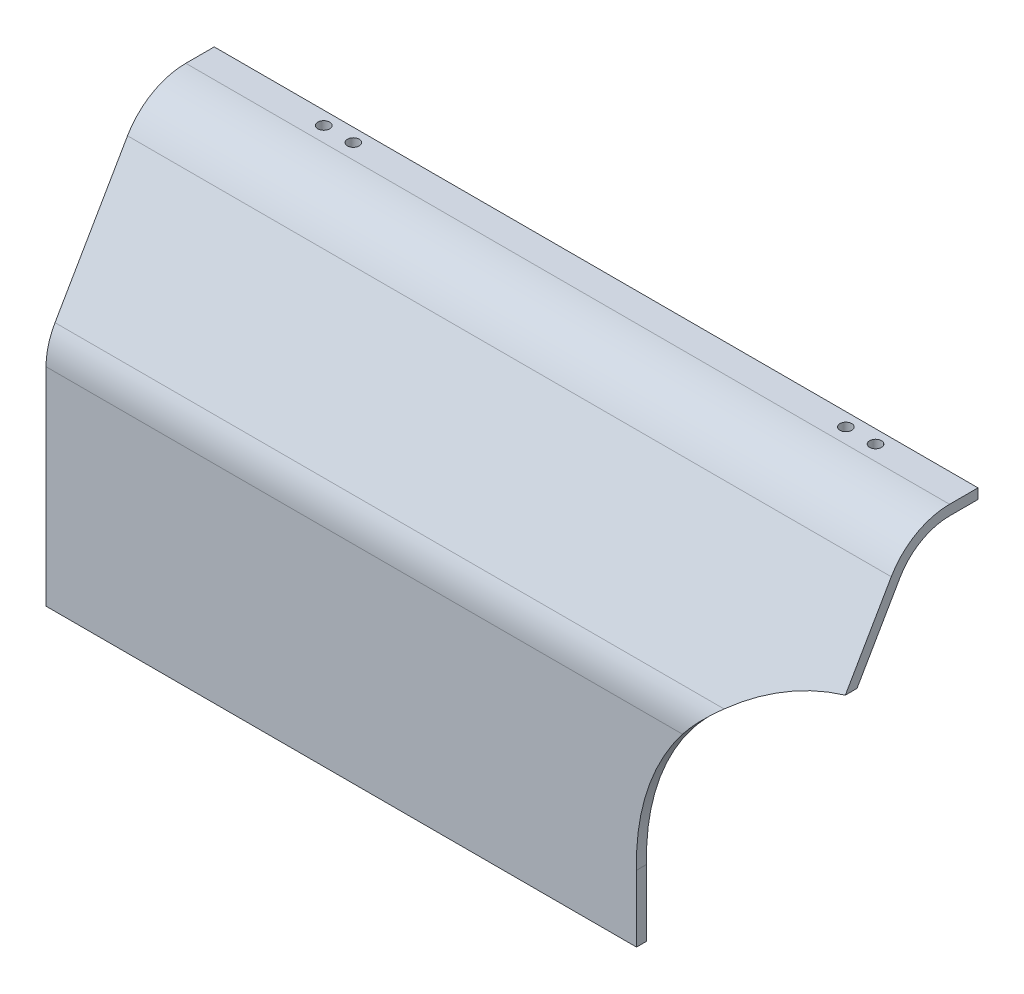
from build123d import *

# Parameters (mm, degrees)
SALIENTE_EXTRUIR1_DEPTH = 113.5
REDONDEO1_R             = 20
REDONDEO2_R             = 20
REDONDEO3_R             = 17
REDONDEO4_R             = 17
CROQUIS4_R              = 1.75
CORTAR_EXTRUIR3_DEPTH   = 4
CROQUIS5_R              = 1.75
CORTAR_EXTRUIR4_DEPTH   = 4
CROQUIS7_R              = 65
CORTAR_EXTRUIR6_DEPTH   = 172.854863901
CORTAR_EXTRUIR7_DEPTH   = 172.854863967


with BuildPart() as part:
    # Croquis1 → Saliente-Extruir1 (new, symmetric)
    with BuildSketch(Plane(origin=(0, 0, 0), x_dir=(0, 0, -1), z_dir=(1, 0, 0))):
        Polygon((0, 0), (0, 66.196152423), (28.732050808, 115.961524227), (47, 115.961524227), (47, 118.961524227), (27, 118.961524227), (-3, 67), (-3, 0), align=None)
    extrude(amount=SALIENTE_EXTRUIR1_DEPTH, both=True)

    # Redondeo1
    redondeo1_edges = [part.edges().sort_by_distance(p)[0] for p in [
        (0, 67, 3),
    ]]
    fillet(redondeo1_edges, radius=REDONDEO1_R)

    # Redondeo2
    redondeo2_edges = [part.edges().sort_by_distance(p)[0] for p in [
        (0, 118.961524227, -27),
    ]]
    fillet(redondeo2_edges, radius=REDONDEO2_R)

    # Redondeo3
    redondeo3_edges = [part.edges().sort_by_distance(p)[0] for p in [
        (0, 115.961524227, -28.732050808),
    ]]
    fillet(redondeo3_edges, radius=REDONDEO3_R)

    # Redondeo4
    redondeo4_edges = [part.edges().sort_by_distance(p)[0] for p in [
        (0, 66.196152423, 0),
    ]]
    fillet(redondeo4_edges, radius=REDONDEO4_R)

    # Croquis4 → Cortar-Extruir3 (cut)
    with BuildSketch(Plane(origin=(0, 118.961524227, 0), x_dir=(1, 0, 0), z_dir=(0, 1, 0))):
        with Locations((-77, 43.047005384)):
            Circle(CROQUIS4_R)
        with Locations((-68.2, 43.047005384)):
            Circle(CROQUIS4_R)
    extrude(amount=-CORTAR_EXTRUIR3_DEPTH, mode=Mode.SUBTRACT)

    # Croquis5 → Cortar-Extruir4 (cut)
    with BuildSketch(Plane(origin=(0, 118.961524227, 0), x_dir=(1, 0, 0), z_dir=(0, 1, 0))):
        with Locations((78.2, 43.047005384)):
            Circle(CROQUIS5_R)
        with Locations((87, 43.047005384)):
            Circle(CROQUIS5_R)
    extrude(amount=-CORTAR_EXTRUIR4_DEPTH, mode=Mode.SUBTRACT)

    # Croquis7 → Cortar-Extruir6 (cut, through all)
    with BuildSketch(Plane.XY.offset(3)):
        with Locations((126.978079309, 21.721524227)):
            Circle(CROQUIS7_R)
    extrude(amount=-CORTAR_EXTRUIR6_DEPTH, mode=Mode.SUBTRACT)

    # Croquis8 → Cortar-Extruir7 (cut, through all)
    with BuildSketch(Plane.XY.offset(3)):
        with BuildLine():
            Line((65.714914314, 0), (62.007039343, 0))
            Line((62.007039343, 0), (62.007039343, 19.781429967))
            ThreePointArc((62.007039343, 19.781429967), (63.090718522, 9.746336063), (65.714914314, 0))
        make_face()
    extrude(amount=-CORTAR_EXTRUIR7_DEPTH, mode=Mode.SUBTRACT)


solid = part.part
